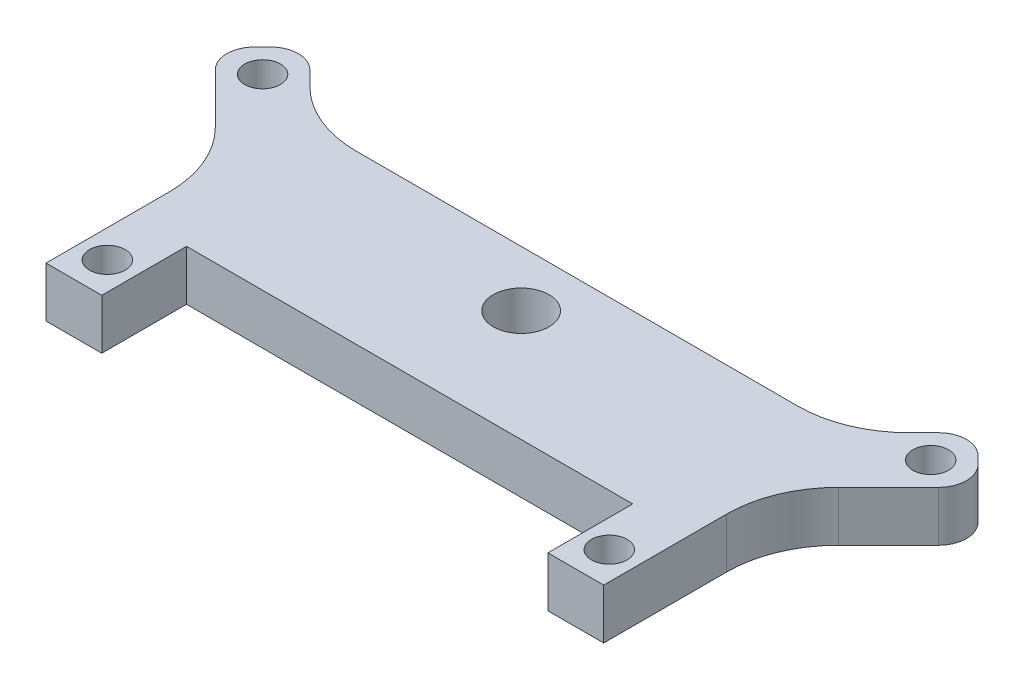
from build123d import *

# Parameters (mm, degrees)
SKETCH1_R           = 1.6
SKETCH1_R_2         = 2.5
BOSS_EXTRUDE1_DEPTH = 4.5
FILLET1_R           = 10
FILLET2_R           = 2.5


with BuildPart() as part:
    # Sketch1 → Boss-Extrude1 (new body)
    with BuildSketch(Plane(origin=(0, 0, 0), x_dir=(1, 0, 0), z_dir=(0, 1, 0))):
        Polygon((-20, 0), (20, 0), (20, -7.6), (25, -7.6), (25, 7.575378798), (34.192388155, 16.767766953), (29.949747468, 21.01040764), (23.939339828, 15), (-23.939339828, 15), (-29.949747468, 21.01040764), (-34.192388155, 16.767766953), (-25, 7.575378798), (-25, -7.6), (-20, -7.6), align=None)
        with Locations((-22.5, -4.6)):
            Circle(SKETCH1_R, mode=Mode.SUBTRACT)
        with Locations((22.5, -4.6)):
            Circle(SKETCH1_R, mode=Mode.SUBTRACT)
        with Locations((-29.949747468, 16.767766953)):
            Circle(SKETCH1_R, mode=Mode.SUBTRACT)
        with Locations((29.949747468, 16.767766953)):
            Circle(SKETCH1_R, mode=Mode.SUBTRACT)
        with Locations((0, 10)):
            Circle(SKETCH1_R_2, mode=Mode.SUBTRACT)
    extrude(amount=BOSS_EXTRUDE1_DEPTH)

    # Fillet1
    fillet1_edges = [part.edges().sort_by_distance(p)[0] for p in [
        (-25, 2.25, -7.575378798),
        (25, 2.25, -7.575378798),
        (23.939339828, 2.25, -15),
        (-23.939339828, 2.25, -15),
    ]]
    fillet(fillet1_edges, radius=FILLET1_R)

    # Fillet2
    fillet2_edges = [part.edges().sort_by_distance(p)[0] for p in [
        (-34.192388155, 2.25, -16.767766953),
        (-29.949747468, 2.25, -21.01040764),
        (29.949747468, 2.25, -21.01040764),
        (34.192388155, 2.25, -16.767766953),
    ]]
    fillet(fillet2_edges, radius=FILLET2_R)


solid = part.part
